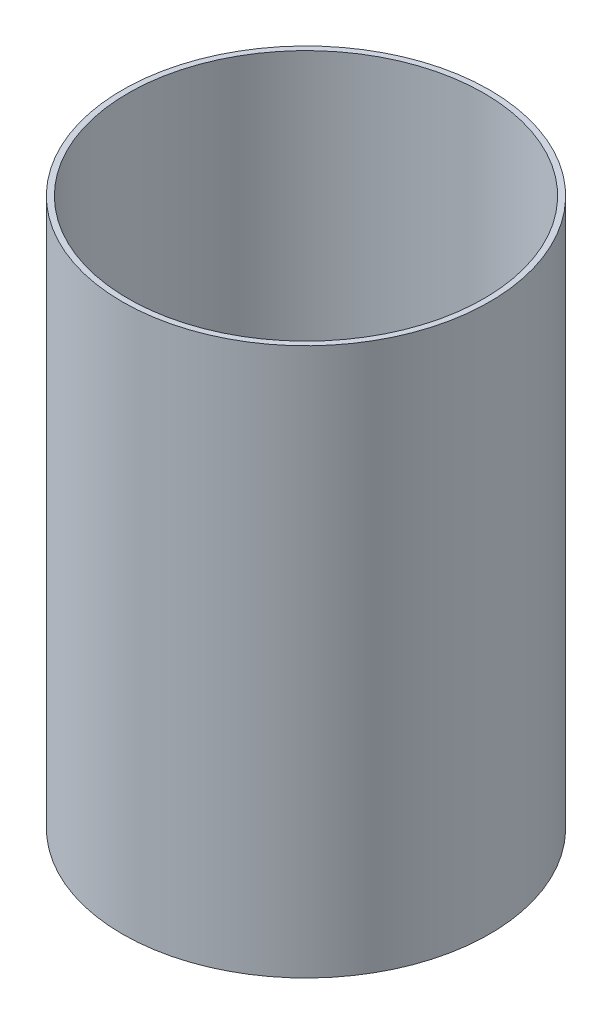
from build123d import *

# Parameters (mm, degrees)
SKETCH1_R           = 51.1048
SKETCH1_R_2         = 49.53
BOSS_EXTRUDE1_DEPTH = 152.4


with BuildPart() as part:
    # Sketch1 → Boss-Extrude1 (new body)
    with BuildSketch(Plane(origin=(0, 0, 0), x_dir=(1, 0, 0), z_dir=(0, 1, 0))):
        Circle(SKETCH1_R)
        Circle(SKETCH1_R_2, mode=Mode.SUBTRACT)
    extrude(amount=BOSS_EXTRUDE1_DEPTH)


solid = part.part
